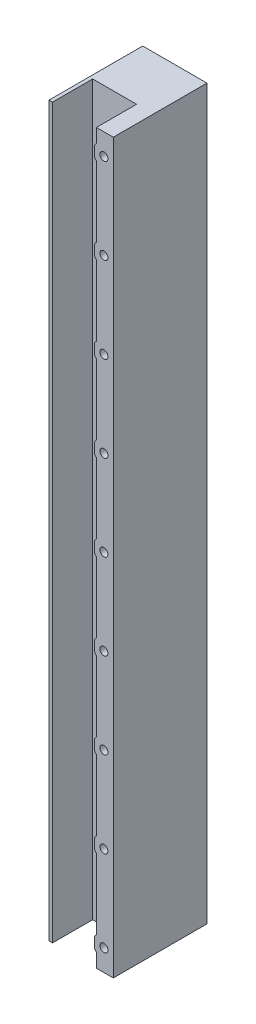
from build123d import *

# Parameters (mm, degrees)
PROFILE_SKETCH_W               = 12
PROFILE_SKETCH_H               = 17.5
PROFILE_EXTRUDE_DEPTH          = 136
POCKET_SKETCH_W                = 8.2
POCKET_SKETCH_H                = 7.5
POCKET_CUT_DEPTH               = 138.645377692
INDEX_HOLE_SKETCH_R            = 0.75
FIRST_INDEX_HOLE_CUT_DEPTH     = 8
INDEX_HOLE_REINFORCEMENT_REACH = 139.645
INDEX_HOLE_PATTERN_COUNT       = 9
INDEX_HOLE_PATTERN_PITCH       = 16


with BuildPart() as part:
    # Profile Sketch → Profile Extrude (new body)
    with BuildSketch(Plane(origin=(0.045617437, 0, -0.024209872), x_dir=(-1, 0, 0), z_dir=(0, 1, 0))):
        with Locations((6.045617437, -8.725790128)):
            Rectangle(PROFILE_SKETCH_W, PROFILE_SKETCH_H)
    extrude(amount=PROFILE_EXTRUDE_DEPTH)

    # Pocket Sketch → Pocket Cut (cut, through all)
    with BuildSketch(Plane(origin=(0, 0, 0), x_dir=(1, 0, 0), z_dir=(0, 1, 0))):
        with Locations((-7.25, 3.75)):
            Rectangle(POCKET_SKETCH_W, POCKET_SKETCH_H)
    extrude(amount=POCKET_CUT_DEPTH, mode=Mode.SUBTRACT)

    # Index Hole Sketch → First Index Hole Cut (cut)
    with BuildSketch(Plane.XY):
        with Locations((-1.75, 4)):
            Circle(INDEX_HOLE_SKETCH_R)
    first_index_hole_cut = extrude(amount=-FIRST_INDEX_HOLE_CUT_DEPTH, mode=Mode.SUBTRACT)

    # Index Hole Reinforcement Sketch → Index Hole Reinforcement (add, up to next)
    with BuildSketch(Plane.XY, mode=Mode.PRIVATE) as index_hole_reinforcement_sk1:
        with BuildLine():
            Line((-3.5, 4.968245837), (-3.5, 3.031754163))
            ThreePointArc((-3.5, 3.031754163), (-3.34170794, 2.789022777), (-3.15, 2.571714314))
            Line((-3.15, 2.571714314), (-3.15, 5.428285686))
            ThreePointArc((-3.15, 5.428285686), (-3.34170794, 5.210977223), (-3.5, 4.968245837))
        make_face()
    index_hole_reinforcement_tool1 = extrude(index_hole_reinforcement_sk1.sketch, amount=-INDEX_HOLE_REINFORCEMENT_REACH, mode=Mode.PRIVATE) - part.part
    index_hole_reinforcement = index_hole_reinforcement_tool1.solids().sort_by_distance((-3.314141, 4, 0))[0]
    add(index_hole_reinforcement)

    # Index Hole Pattern: First Index Hole Cut, Index Hole Reinforcement ×9
    with Locations(*[(0, i * INDEX_HOLE_PATTERN_PITCH, 0) for i in range(1, INDEX_HOLE_PATTERN_COUNT)]):
        add(first_index_hole_cut, mode=Mode.SUBTRACT)
        add(index_hole_reinforcement)


solid = part.part
